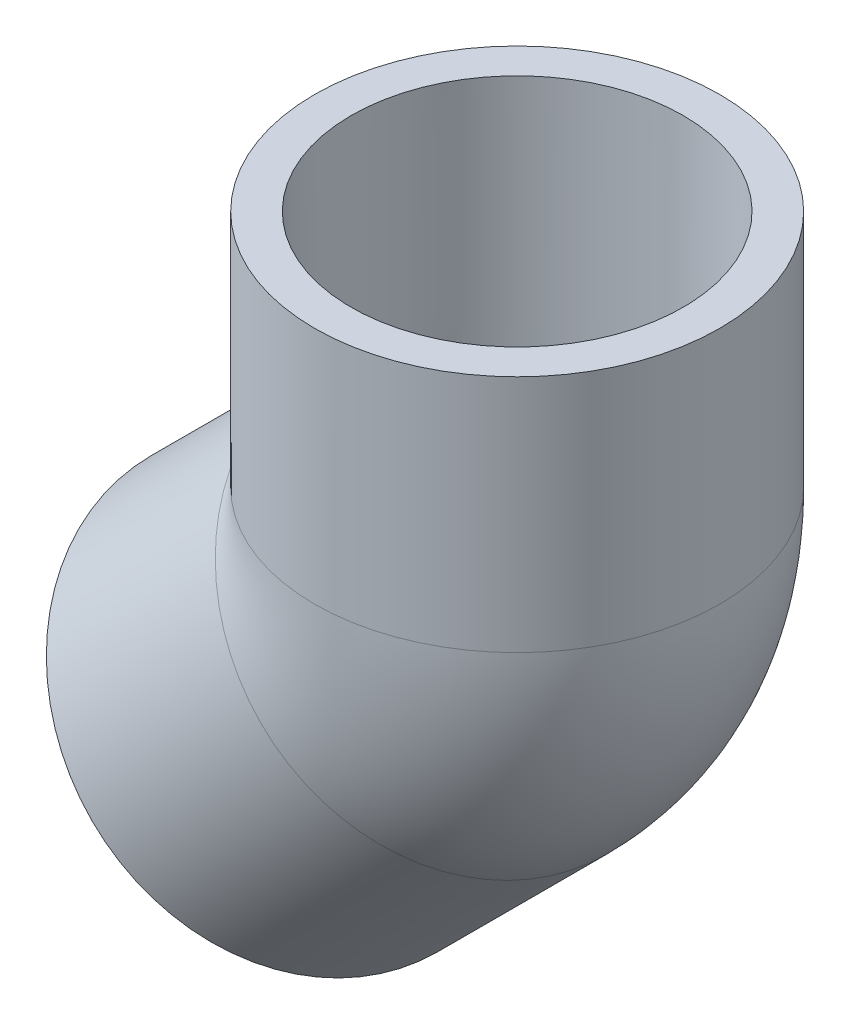
from build123d import *

# Parameters (mm, degrees)
SWEEP1_OUTLINE_R = 19.05
SWEEP1_ANGLE     = 45


# Read off the part's stored shape, not the designer's step: Sweep1
with BuildPart() as part:
    # Sketch1 → Revolve1 (revolve)
    with BuildSketch(Plane.XY):
        Polygon((-11.620451421, -53.504365969), (13.075252912, -28.808661636), (9.141900731, -24.875309455), (-15.392158992, -49.732658398), align=None)
    revolve(axis=Axis((-32.562408695, -32.562408695, 0), (0.7071067811865489, 0.7071067811865462, 0)))



with BuildPart() as body_2:
    # Sketch2 → Revolve2 (revolve)
    with BuildSketch(Plane.XY, mode=Mode.PRIVATE) as revolve2_sk:
        Polygon((24.2824, 46.0502), (24.0538, 11.1252), (29.6164, 11.1252), (29.6164, 46.0502), align=None)
    revolve(revolve2_sk.sketch.rotate(Axis((0, 0, 0), (0, 1, 0)), 90), axis=Axis((0, 0, 0), (0, 1, 0)))


with BuildPart() as part_1:
    add(part.part)

    add(body_2.part)  # Sweep1 merges body 2
    # Sweep1 outline → Sweep1 (revolve)
    with BuildSketch(Plane(origin=(-26.858608724, 11.1252, 0), x_dir=(0.7071067811865456, -0.7071067811865495, 0), z_dir=(-0.7071067811865495, -0.7071067811865456, 0))):
        with BuildLine():
            add(Edge.make_bspline(
                [(0, -12.47983519), (2.433019071, -17.716082804), (6.462098408, -23.031102055), (12.420065701, -27.510436974), (19.826637315, -29.616399972), (31.148102021, -29.616400017), (35.350347429, -28.839458719), (39.166266978, -27.352692198), (42.453436256, -25.423168026), (48.864453991, -20.358724486), (52.300672966, -16.481011645), (55.081198052, -11.509174867), (57.861133983, 2.29e-07), (55.081197854, 11.509175223), (52.300672802, 16.48101183), (48.864453905, 20.358724554), (42.45343625, 25.42316803), (39.166266965, 27.352692206), (35.350347405, 28.839458728), (31.148101986, 29.616400023), (19.826637279, 29.616399962), (12.420065679, 27.510436958), (6.462098398, 23.031102041), (2.433019068, 17.716082798), (0, 12.47983519)],
                knots=[7.869052735, 7.869052735, 7.869052735, 7.869052735, 7.869052735, 7.869052735, 8.989808634, 8.989808634, 8.989808634, 8.989808634, 9.673468285, 9.673468285, 9.673468285, 9.673468285, 10.575676072, 10.575676072, 10.575676072, 11.477883836, 11.477883836, 11.477883836, 11.477883836, 12.16154349, 12.16154349, 12.16154349, 12.16154349, 13.282299387, 13.282299387, 13.282299387, 13.282299387, 13.282299387, 13.282299387], degree=5, weights=[1, 1, 0.994925079, 0.991017204, 1, 1, 0.999543135, 1.000026004, 1, 1, 0.998930688, 0.997235364, 1.002764636, 0.997235364, 0.998930688, 1, 1, 1.000026004, 0.999543135, 1, 1, 0.991017204, 0.994925079, 1, 1]))
            Line((0, 12.47983519), (0, -12.47983519))
        make_face()
        with Locations((26.858608724, 0)):
            Circle(SWEEP1_OUTLINE_R, mode=Mode.SUBTRACT)
    revolve(axis=Axis((-26.858608724, 11.1252, 0), (0, 0, 1)), revolution_arc=SWEEP1_ANGLE)


solid = part_1.part
